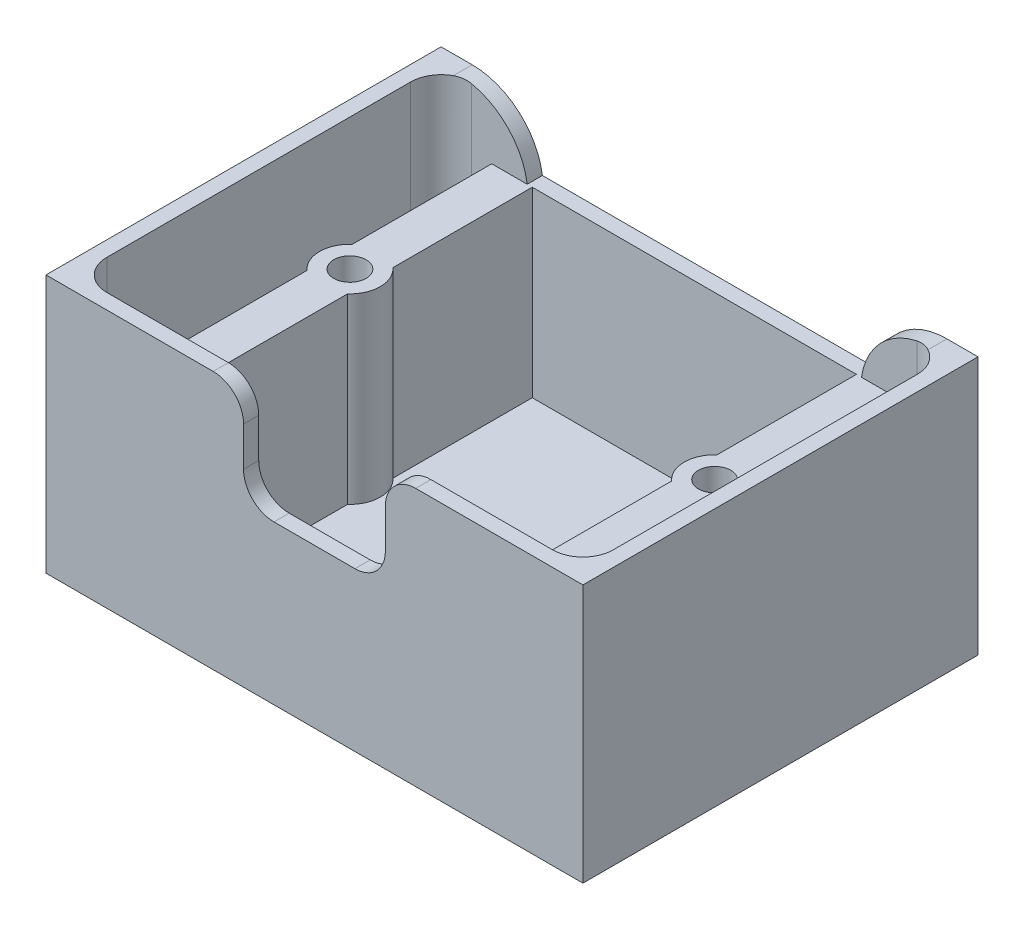
from build123d import *

# Parameters (mm, degrees)
SKETCH1_W           = 50
SKETCH1_H           = 36
BOSS_EXTRUDE1_DEPTH = 24
SHELL1_T            = 1.5
SKETCH2_W           = 4
SKETCH2_H           = 36
BOSS_EXTRUDE2_DEPTH = 18
SKETCH6_W           = 14
SKETCH6_H           = 14
CUT_EXTRUDE2_DEPTH  = 10
FILLET1_R           = 3
SKETCH4_R           = 3
BOSS_EXTRUDE3_DEPTH = 18
SKETCH7_R           = 1.6
CUT_EXTRUDE3_DEPTH  = 12
SKETCH8_W           = 33
SKETCH8_H           = 8
CUT_EXTRUDE4_DEPTH  = 5
FILLET3_R           = 7


with BuildPart() as part:
    # Sketch1 → Boss-Extrude1 (new body)
    with BuildSketch(Plane(origin=(0, 0, 0), x_dir=(1, 0, 0), z_dir=(0, 1, 0))):
        with Locations((25, -18)):
            Rectangle(SKETCH1_W, SKETCH1_H)
    extrude(amount=BOSS_EXTRUDE1_DEPTH)

    # Shell1
    shell1_openings = [part.faces().sort_by_distance(p)[0] for p in [
        (25, 24, 18),
    ]]
    offset(amount=SHELL1_T, openings=shell1_openings, kind=Kind.INTERSECTION)

    # Sketch2 → Boss-Extrude2 (add)
    with BuildSketch(Plane(origin=(0, 0, 0), x_dir=(1, 0, 0), z_dir=(0, 1, 0))):
        with Locations((7, -18)):
            Rectangle(SKETCH2_W, SKETCH2_H)
        with Locations((43, -18)):
            Rectangle(SKETCH2_W, SKETCH2_H)
    extrude(amount=BOSS_EXTRUDE2_DEPTH)

    # Sketch6 → Cut-Extrude2 (cut)
    with BuildSketch(Plane.XY.offset(37.5)):
        with Locations((25, 21.134691447)):
            Rectangle(SKETCH6_W, SKETCH6_H)
    extrude(amount=-CUT_EXTRUDE2_DEPTH, mode=Mode.SUBTRACT)

    # Fillet1
    fillet1_edges = [part.edges().sort_by_distance(p)[0] for p in [
        (0, 12, 0),
        (0, 12, 36),
        (50, 12, 36),
        (50, 12, 0),
        (32, 24, 36.75),
        (18, 24, 36.75),
        (18, 14.134691447, 36.75),
        (32, 14.134691447, 36.75),
    ]]
    fillet(fillet1_edges, radius=FILLET1_R)

    # Sketch4 → Boss-Extrude3 (add)
    with BuildSketch(Plane(origin=(0, 18, 0), x_dir=(1, 0, 0), z_dir=(0, 1, 0))):
        with Locations((7, -16)):
            Circle(SKETCH4_R)
        with Locations((43, -16)):
            Circle(SKETCH4_R)
    extrude(amount=-BOSS_EXTRUDE3_DEPTH)

    # Sketch7 → Cut-Extrude3 (cut)
    with BuildSketch(Plane(origin=(0, 18, 0), x_dir=(1, 0, 0), z_dir=(0, 1, 0))):
        with Locations(Location((7, -16, 0), (0, 0, 270))):
            Circle(SKETCH7_R)
        with Locations(Location((43, -16, 0), (0, 0, 90))):
            Circle(SKETCH7_R)
    extrude(amount=-CUT_EXTRUDE3_DEPTH, mode=Mode.SUBTRACT)

    # Sketch8 → Cut-Extrude4 (cut)
    with BuildSketch(Plane(origin=(0, 0, -1.5), x_dir=(-1, 0, 0), z_dir=(0, 0, -1))):
        with Locations((-25, 22)):
            Rectangle(SKETCH8_W, SKETCH8_H)
    extrude(amount=-CUT_EXTRUDE4_DEPTH, mode=Mode.SUBTRACT)

    # Fillet3
    # the kernel refuses this fillet: 7 mm, written as the material it takes off along each edge
    with BuildSketch(Plane(origin=(41.5, 24, -18.820508076), x_dir=(0, -1, 0), z_dir=(0, 0, 1))) as fillet3_piece_1:
        with BuildLine():
            CenterArc((7, 6.92820323), FILLET3_R, 180, 81.786789298)
            Line((0, 6.92820323), (-0.14, 6.92820323))
            Line((-0.14, 6.92820323), (-0.14, 0))
            Line((-0.14, 0), (0, -0.14))
            ThreePointArc((0, -0.14), (3, -0.14), (5.98, -0.138564065))
            Line((5.98, -0.138564065), (6, 0))
        make_face()
    extrude(amount=36.141016151, mode=Mode.SUBTRACT)
    with BuildSketch(Plane(origin=(8.5, 24, 17.320508076), x_dir=(-1, 0, 0), z_dir=(0, 0, -1))) as fillet3_piece_2:
        with BuildLine():
            CenterArc((6.92820323, -7), FILLET3_R, 90, 81.786789298)
            Line((0, -6), (-0.138564065, -5.98))
            ThreePointArc((-0.138564065, -5.98), (-0.14, -3), (-0.14, 0))
            Line((-0.14, 0), (0, 0.14))
            Line((0, 0.14), (6.92820323, 0.14))
            Line((6.92820323, 0.14), (6.92820323, 0))
        make_face()
    extrude(amount=36.141016151, mode=Mode.SUBTRACT)


solid = part.part
